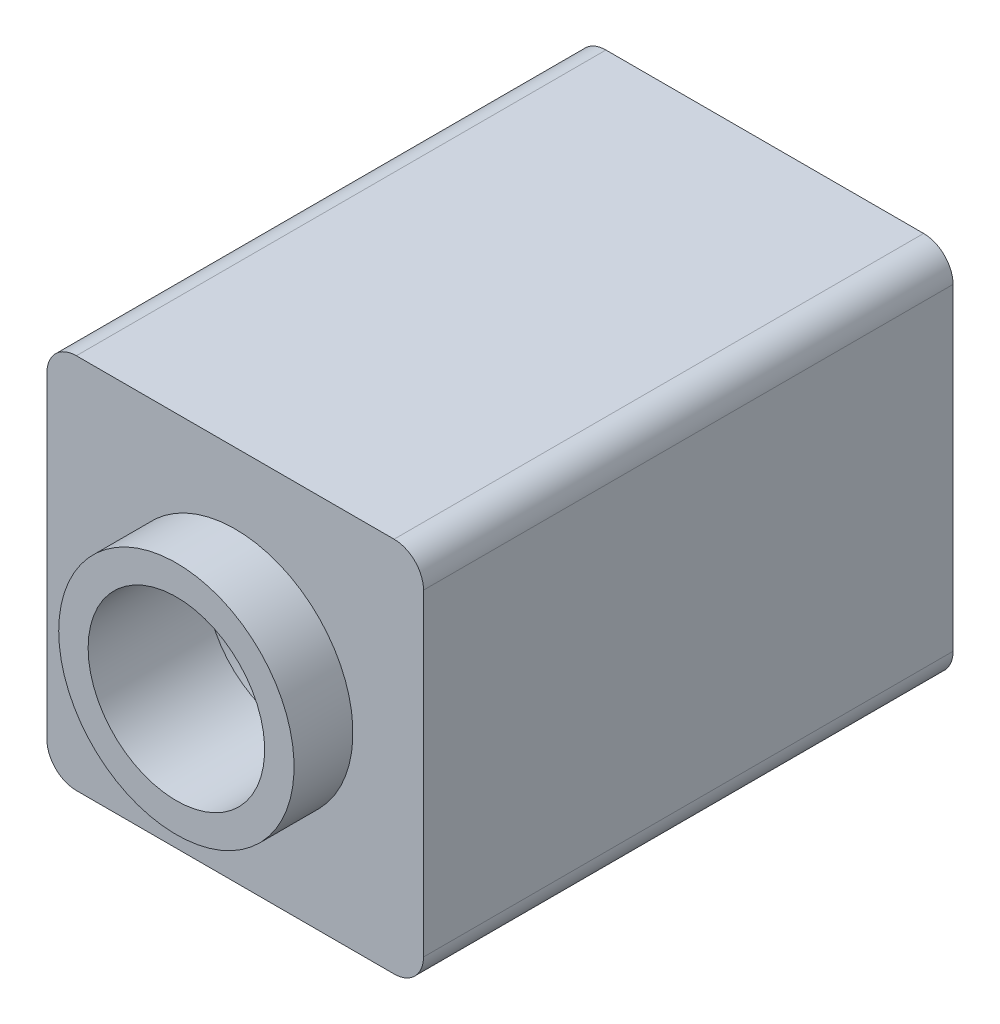
from build123d import *

# Parameters (mm, degrees)
SKETCH2_R           = 1.5
BOSS_EXTRUDE1_DEPTH = 10
SKETCH3_R           = 2
CUT_EXTRUDE1_DEPTH  = 1
SKETCH4_R           = 2.4
CUT_EXTRUDE2_DEPTH  = 8


with BuildPart() as part:
    # Sketch2 → Boss-Extrude1 (new body)
    with BuildSketch(Plane(origin=(0, 0, -57.465471353), x_dir=(-1, 0, 0), z_dir=(0, 0, -1))):
        with BuildLine():
            Line((-6.440457264, -35.028386779), (-1.040457264, -35.028386779))
            ThreePointArc((-1.040457264, -35.028386779), (-0.686903873, -34.881940169), (-0.540457264, -34.528386779))
            Line((-0.540457264, -34.528386779), (-0.540457264, -29.128386779))
            ThreePointArc((-0.540457264, -29.128386779), (-0.686903873, -28.774833388), (-1.040457264, -28.628386779))
            Line((-1.040457264, -28.628386779), (-6.440457264, -28.628386779))
            ThreePointArc((-6.440457264, -28.628386779), (-6.794010654, -28.774833388), (-6.940457264, -29.128386779))
            Line((-6.940457264, -29.128386779), (-6.940457264, -34.528386779))
            ThreePointArc((-6.940457264, -34.528386779), (-6.794010654, -34.881940169), (-6.440457264, -35.028386779))
        make_face()
        with Locations((-3.740457264, -31.828386779)):
            Circle(SKETCH2_R, mode=Mode.SUBTRACT)
    extrude(amount=BOSS_EXTRUDE1_DEPTH)

    # Sketch3 → Cut-Extrude1 (cut)
    with BuildSketch(Plane(origin=(0, 0, -57.465471353), x_dir=(-1, 0, 0), z_dir=(0, 0, -1))):
        with BuildLine():
            Line((-1.040457264, -28.628386779), (-6.440457264, -28.628386779))
            ThreePointArc((-6.440457264, -28.628386779), (-6.794010654, -28.774833388), (-6.940457264, -29.128386779))
            Line((-6.940457264, -29.128386779), (-6.940457264, -34.528386779))
            ThreePointArc((-6.940457264, -34.528386779), (-6.794010654, -34.881940169), (-6.440457264, -35.028386779))
            Line((-6.440457264, -35.028386779), (-1.040457264, -35.028386779))
            ThreePointArc((-1.040457264, -35.028386779), (-0.686903873, -34.881940169), (-0.540457264, -34.528386779))
            Line((-0.540457264, -34.528386779), (-0.540457264, -29.128386779))
            ThreePointArc((-0.540457264, -29.128386779), (-0.686903873, -28.774833388), (-1.040457264, -28.628386779))
        make_face()
        with Locations((-3.740457264, -31.828386779)):
            Circle(SKETCH3_R, mode=Mode.SUBTRACT)
    extrude(amount=CUT_EXTRUDE1_DEPTH, mode=Mode.SUBTRACT)

    # Sketch4 → Cut-Extrude2 (cut)
    with BuildSketch(Plane(origin=(0, 0, -67.465471353), x_dir=(-1, 0, 0), z_dir=(0, 0, -1))):
        with Locations((-3.740457264, -31.828386779)):
            Circle(SKETCH4_R)
    extrude(amount=-CUT_EXTRUDE2_DEPTH, mode=Mode.SUBTRACT)


solid = part.part
